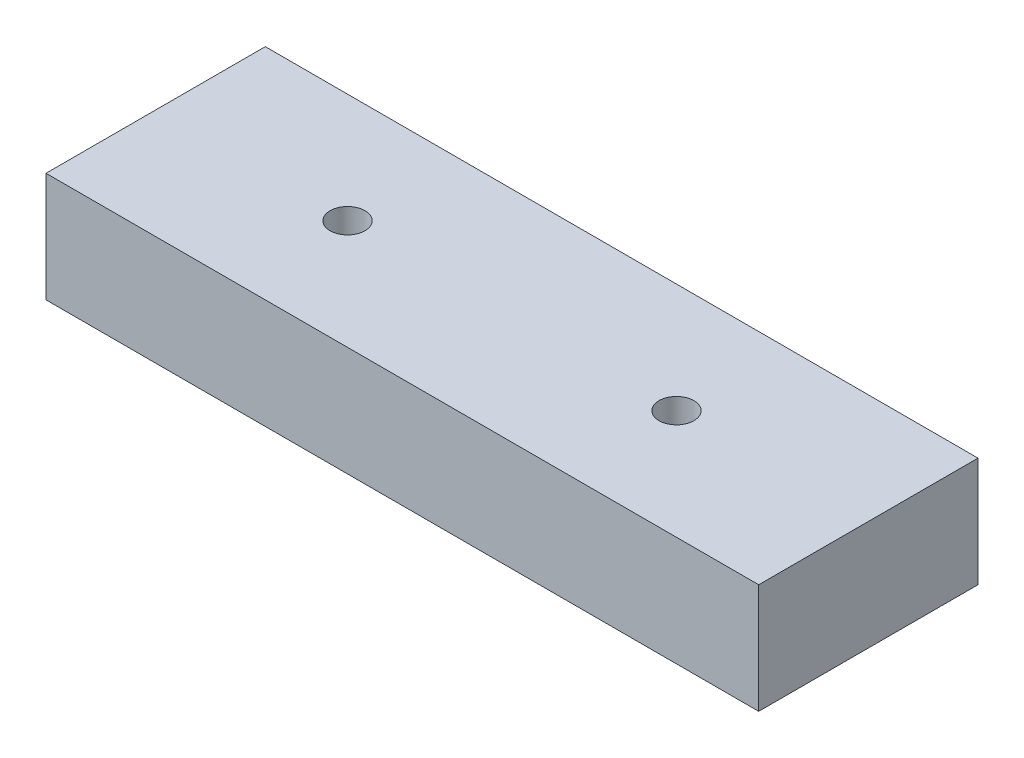
from build123d import *

# Parameters (mm, degrees)
SKETCH2_W              = 82.55
SKETCH2_H              = 25.4
BOSS_EXTRUDE1_DEPTH    = 12.7
BOSS_EXTRUDE2_DEPTH    = 3.175
F_10_32_TAPPED_HOLE1_D = 4.0386


with BuildPart() as part:
    # Sketch2 → Boss-Extrude1 (new body)
    with BuildSketch(Plane(origin=(0, 0, 0), x_dir=(1, 0, 0), z_dir=(0, 1, 0))):
        Rectangle(SKETCH2_W, SKETCH2_H)
    extrude(amount=BOSS_EXTRUDE1_DEPTH)

    # Sketch5 → Boss-Extrude2 (add)
    with BuildSketch(Plane.XZ):
        with BuildLine():
            Line((-31.75, 3.175), (-19.05, 3.175))
            ThreePointArc((-19.05, 3.175), (-15.875, 0), (-19.05, -3.175))
            Line((-19.05, -3.175), (-31.75, -3.175))
            ThreePointArc((-31.75, -3.175), (-34.925, 0), (-31.75, 3.175))
        make_face()
        with BuildLine():
            Line((-6.35, 3.175), (6.35, 3.175))
            ThreePointArc((6.35, 3.175), (9.525, 0), (6.35, -3.175))
            Line((6.35, -3.175), (-6.35, -3.175))
            ThreePointArc((-6.35, -3.175), (-9.525, 0), (-6.35, 3.175))
        make_face()
        with BuildLine():
            Line((19.05, 3.175), (31.75, 3.175))
            ThreePointArc((31.75, 3.175), (34.925, 0), (31.75, -3.175))
            Line((31.75, -3.175), (19.05, -3.175))
            ThreePointArc((19.05, -3.175), (15.875, 0), (19.05, 3.175))
        make_face()
    extrude(amount=BOSS_EXTRUDE2_DEPTH)

    # #10-32 Tapped Hole1 (through all)
    with Locations(Plane(origin=(0, -3.175, 0), x_dir=(-1, 0, 0), z_dir=(0, -1, 0))):
        with Locations((19.05, 0), (-19.05, 0)):
            Hole(F_10_32_TAPPED_HOLE1_D / 2)


solid = part.part
